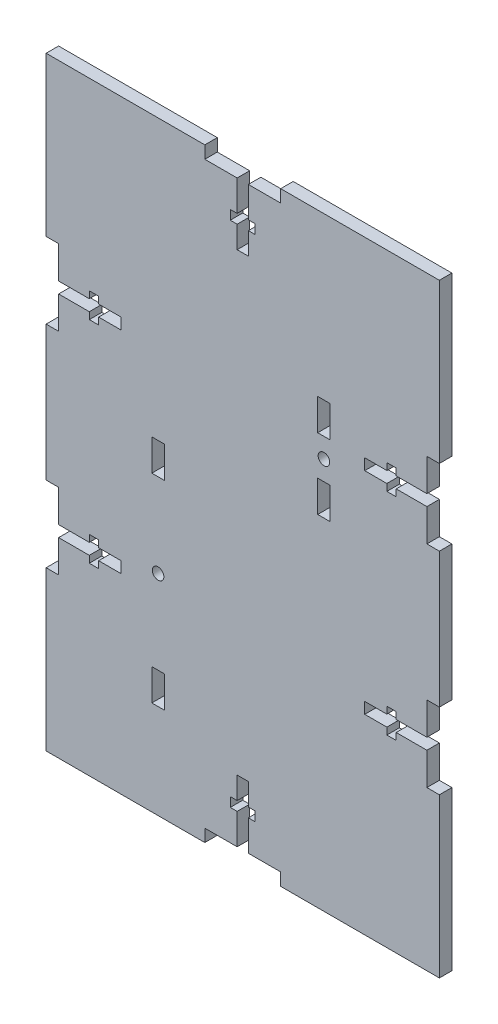
from build123d import *

# Parameters (mm, degrees)
BOSS_EXTRUDE1_DEPTH = 3.18
CUT_EXTRUDE9_DEPTH  = 92.718008183
CUT_EXTRUDE10_DEPTH = 92.718008183
SKETCH32_4_W        = 3.18
SKETCH32_4_H        = 8
SKETCH32_4_R        = 1.47
CUT_EXTRUDE18_DEPTH = 92.718008183
SKETCH33_R          = 1.47
SKETCH33_W          = 3.18
SKETCH33_H          = 8
CUT_EXTRUDE22_DEPTH = 92.718008183


with BuildPart() as part:
    # Sketch1 → Boss-Extrude1 (new body)
    with BuildSketch(Plane.XY):
        Polygon((-50, 76.825), (-16.666666667, 76.825), (16.666666667, 76.825), (50, 76.825), (50, -76.825), (-50, -76.825), align=None)
    extrude(amount=BOSS_EXTRUDE1_DEPTH)

    # Sketch20 → Cut-Extrude9 (cut, through all)
    with BuildSketch(Plane.XY.offset(3.18)):
        Polygon((-9.65, 76.825), (9.65, 76.825), (9.65, 73.645), (1.425, 73.645), (1.425, 65.845), (3.175, 65.845), (3.175, 63.465), (1.425, 63.465), (1.425, 57.845), (-1.425, 57.845), (-1.425, 63.465), (-3.175, 63.465), (-3.175, 65.845), (-1.425, 65.845), (-1.425, 73.645), (-9.65, 73.645), align=None)
    cut_extrude9 = extrude(amount=-CUT_EXTRUDE9_DEPTH, mode=Mode.SUBTRACT)

    # Mirror3: Cut-Extrude9 across plane
    add(cut_extrude9.mirror(Plane.ZX), mode=Mode.SUBTRACT)

    # Sketch23 → Cut-Extrude10 (cut, through all)
    with BuildSketch(Plane.XY.offset(3.18)):
        Polygon((-50, 17.175), (-50, 36.475), (-46.82, 36.475), (-46.82, 28.25), (-39.02, 28.25), (-39.02, 30), (-36.64, 30), (-36.64, 28.25), (-31.02, 28.25), (-31.02, 25.4), (-36.64, 25.4), (-36.64, 23.65), (-39.02, 23.65), (-39.02, 25.4), (-46.82, 25.4), (-46.82, 17.175), align=None)
        Polygon((-50, -36.475), (-50, -17.175), (-46.82, -17.175), (-46.82, -25.4), (-39.02, -25.4), (-39.02, -23.65), (-36.64, -23.65), (-36.64, -25.4), (-31.02, -25.4), (-31.02, -28.25), (-36.64, -28.25), (-36.64, -30), (-39.02, -30), (-39.02, -28.25), (-46.82, -28.25), (-46.82, -36.475), align=None)
    cut_extrude10 = extrude(amount=-CUT_EXTRUDE10_DEPTH, mode=Mode.SUBTRACT)

    # Mirror4: Cut-Extrude10 across plane
    add(cut_extrude10.mirror(Plane(origin=(0, 0, 0), x_dir=(0, 0, 1), z_dir=(1, 0, 0))), mode=Mode.SUBTRACT)

    # Sketch32<4> → Cut-Extrude18 (cut, through all)
    with BuildSketch(Plane.XY.offset(3.18)):
        with Locations((20.65, 13.782937163)):
            Rectangle(SKETCH32_4_W, SKETCH32_4_H)
        with Locations((20.65, 31.782937163)):
            Rectangle(SKETCH32_4_W, SKETCH32_4_H)
        with Locations((20.65, 22.782937163)):
            Circle(SKETCH32_4_R)
    extrude(amount=-CUT_EXTRUDE18_DEPTH, mode=Mode.SUBTRACT)

    # Sketch33 → Cut-Extrude22 (cut, through all)
    with BuildSketch(Plane.XY):
        with Locations((-21.530032845, -23.511577341)):
            Circle(SKETCH33_R)
        with Locations((-21.530032845, -48.811577341)):
            Rectangle(SKETCH33_W, SKETCH33_H)
        with Locations((-21.530032845, 1.788422659)):
            Rectangle(SKETCH33_W, SKETCH33_H)
    extrude(amount=CUT_EXTRUDE22_DEPTH, mode=Mode.SUBTRACT)


solid = part.part
